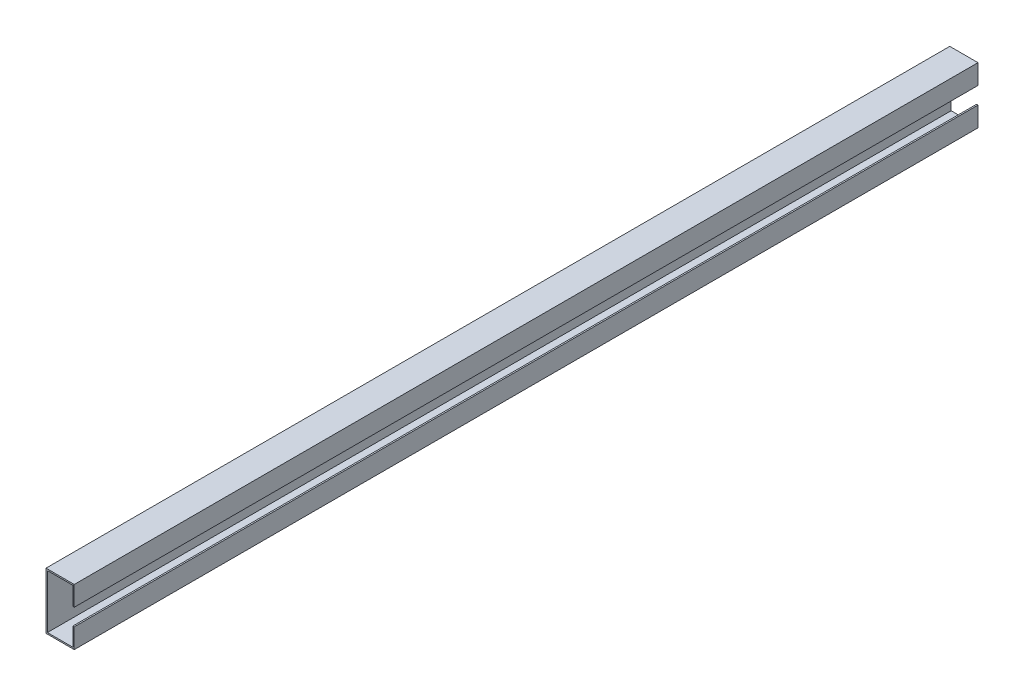
from build123d import *

# Parameters (mm, degrees)
CROQUIS1_W              = 50
CROQUIS1_H              = 100
CROQUIS1_W_2            = 45
CROQUIS1_H_2            = 95
SALIENTE_EXTRUIR1_DEPTH = 800
CROQUIS2_W              = 1600
CROQUIS2_H              = 30
CORTAR_EXTRUIR1_DEPTH   = 5
CROQUIS8_R              = 7.14375
CORTAR_EXTRUIR3_DEPTH   = 804.11892021


with BuildPart() as part:
    # Croquis1 → Saliente-Extruir1 (new, symmetric)
    with BuildSketch(Plane.XY):
        Rectangle(CROQUIS1_W, CROQUIS1_H)
        Rectangle(CROQUIS1_W_2, CROQUIS1_H_2, mode=Mode.SUBTRACT)
    extrude(amount=SALIENTE_EXTRUIR1_DEPTH, both=True)

    # Croquis2 → Cortar-Extruir1 (cut)
    with BuildSketch(Plane(origin=(25, 0, 0), x_dir=(0, 0, -1), z_dir=(1, 0, 0))):
        Rectangle(CROQUIS2_W, CROQUIS2_H)
    extrude(amount=-CORTAR_EXTRUIR1_DEPTH, mode=Mode.SUBTRACT)

    # Croquis8 → Cortar-Extruir3 (cut, through all)
    with BuildSketch(Plane.ZY.offset(25)):
        Circle(CROQUIS8_R)
        with Locations((100, 0)):
            Circle(CROQUIS8_R)
        with Locations((200, 0)):
            Circle(CROQUIS8_R)
        with Locations((300, 0)):
            Circle(CROQUIS8_R)
        with Locations((400, 0)):
            Circle(CROQUIS8_R)
        with Locations((500, 0)):
            Circle(CROQUIS8_R)
        with Locations((600, 0)):
            Circle(CROQUIS8_R)
        with Locations((700, 0)):
            Circle(CROQUIS8_R)
        with Locations((-100, 0)):
            Circle(CROQUIS8_R)
        with Locations((-200, 0)):
            Circle(CROQUIS8_R)
        with Locations((-300, 0)):
            Circle(CROQUIS8_R)
        with Locations((-400, 0)):
            Circle(CROQUIS8_R)
        with Locations((-500, 0)):
            Circle(CROQUIS8_R)
        with Locations((-600, 0)):
            Circle(CROQUIS8_R)
        with Locations((-700, 0)):
            Circle(CROQUIS8_R)
    extrude(amount=-CORTAR_EXTRUIR3_DEPTH, mode=Mode.SUBTRACT)


solid = part.part
